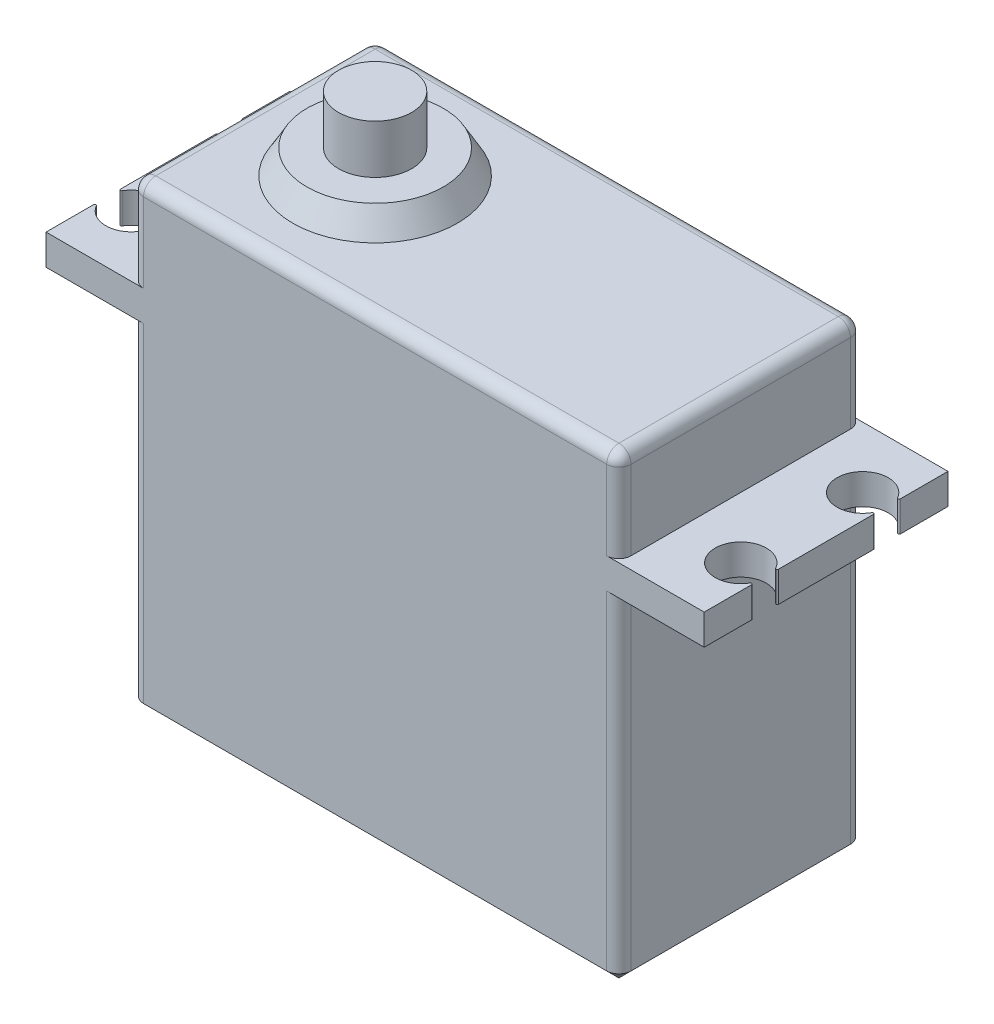
from build123d import *

# Parameters (mm, degrees)
SKETCH1_W           = 40
SKETCH1_H           = 20
BOSS_EXTRUDE1_DEPTH = 28
SKETCH2_W           = 54
SKETCH2_H           = 20
BOSS_EXTRUDE2_DEPTH = 2.5
SKETCH3_W           = 40
SKETCH3_H           = 20
BOSS_EXTRUDE3_DEPTH = 7.5
SKETCH4_R           = 6.75
BOSS_EXTRUDE4_DEPTH = 2
SKETCH5_R           = 3
BOSS_EXTRUDE5_DEPTH = 4
FILLET1_R           = 1
CHAMFER1_SIZE       = 1
CHAMFER2_SIZE2      = 1.154700538
CHAMFER2_SIZE       = 2
SKETCH6_R           = 2.1
CUT_EXTRUDE1_DEPTH  = 60.491596045
FILLET2_R           = 0.1


with BuildPart() as part:
    # Sketch1 → Boss-Extrude1 (new body)
    with BuildSketch(Plane(origin=(0, 0, 0), x_dir=(1, 0, 0), z_dir=(0, 1, 0))):
        with Locations((20, 10)):
            Rectangle(SKETCH1_W, SKETCH1_H)
    extrude(amount=BOSS_EXTRUDE1_DEPTH)

    # Sketch2 → Boss-Extrude2 (add)
    with BuildSketch(Plane(origin=(0, 28, 0), x_dir=(1, 0, 0), z_dir=(0, 1, 0))):
        with Locations((20, 10)):
            Rectangle(SKETCH2_W, SKETCH2_H)
    extrude(amount=BOSS_EXTRUDE2_DEPTH)

    # Sketch3 → Boss-Extrude3 (add)
    with BuildSketch(Plane(origin=(0, 30.5, 0), x_dir=(1, 0, 0), z_dir=(0, 1, 0))):
        with Locations((20, 10)):
            Rectangle(SKETCH3_W, SKETCH3_H)
    extrude(amount=BOSS_EXTRUDE3_DEPTH)

    # Sketch4 → Boss-Extrude4 (add)
    with BuildSketch(Plane(origin=(0, 38, 0), x_dir=(1, 0, 0), z_dir=(0, 1, 0))):
        with Locations(Location((10, 10, 0), (0, 0, 270))):
            Circle(SKETCH4_R)
    extrude(amount=BOSS_EXTRUDE4_DEPTH)

    # Sketch5 → Boss-Extrude5 (add)
    with BuildSketch(Plane(origin=(0, 40, 0), x_dir=(1, 0, 0), z_dir=(0, 1, 0))):
        with Locations(Location((10, 10, 0), (0, 0, 270))):
            Circle(SKETCH5_R)
    extrude(amount=BOSS_EXTRUDE5_DEPTH)

    # Fillet1
    fillet1_edges = [part.edges().sort_by_distance(p)[0] for p in [
        (40, 14, -20),
        (40, 34.25, -20),
        (40, 34.25, 0),
        (40, 14, 0),
        (0, 34.25, 0),
        (0, 14, 0),
        (0, 14, -20),
        (0, 34.25, -20),
        (20, 38, -20),
        (40, 38, -10),
        (0, 38, -10),
        (20, 38, 0),
    ]]
    fillet(fillet1_edges, radius=FILLET1_R)

    # Chamfer1
    chamfer1_edges = [part.edges().sort_by_distance(p)[0] for p in [
        (20, 0, -20),
        (0, 0, -10),
        (40, 0, -10),
        (20, 0, 0),
        (0.292893219, 0, -19.707106781),
        (0.292893219, 0, -0.292893219),
        (39.707106781, 0, -0.292893219),
        (39.707106781, 0, -19.707106781),
    ]]
    chamfer(chamfer1_edges, length=CHAMFER1_SIZE)

    # Chamfer2
    chamfer2_edges = [part.edges().sort_by_distance(p)[0] for p in [
        (10, 40, -16.75),
    ]]
    chamfer2_side = [part.faces().sort_by_distance(p)[0] for p in [
        (10, 39.976905989, -16.75),
    ]]
    chamfer(chamfer2_edges, length=CHAMFER2_SIZE - 0.0001, length2=CHAMFER2_SIZE2 - 0.0001, reference=chamfer2_side[0])  # a hair under: the kernel refuses the full size

    # Sketch6 → Cut-Extrude1 (cut, through all)
    with BuildSketch(Plane(origin=(0, 30.5, 0), x_dir=(1, 0, 0), z_dir=(0, 1, 0))):
        with Locations((-5, 5)):
            Circle(SKETCH6_R)
        with Locations((-5, 15)):
            Circle(SKETCH6_R)
    cut_extrude1 = extrude(amount=-CUT_EXTRUDE1_DEPTH, mode=Mode.SUBTRACT)

    # Mirror2: Cut-Extrude1 across plane
    add(cut_extrude1.mirror(Plane.ZY.offset(-20)), mode=Mode.SUBTRACT)

    # Fillet2
    fillet2_edges = [part.edges().sort_by_distance(p)[0] for p in [
        (-7, 29.25, -4.359687576),
        (-7, 29.25, -5.640312424),
        (-7, 29.25, -15.640312424),
        (-7, 29.25, -14.359687576),
        (47, 29.25, -4.359687576),
        (47, 29.25, -5.640312424),
        (47, 29.25, -14.359687576),
        (47, 29.25, -15.640312424),
    ]]
    fillet(fillet2_edges, radius=FILLET2_R)


solid = part.part
